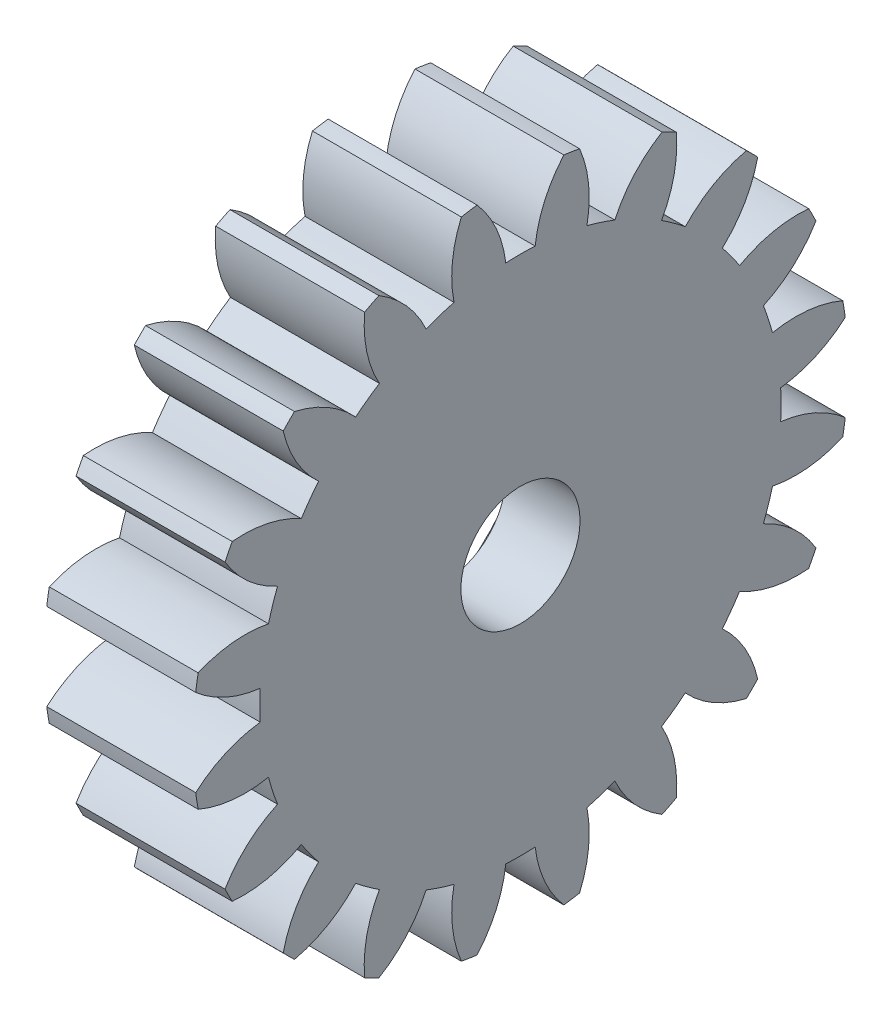
from build123d import *

# Parameters (mm, degrees)
SKETCH1_R           = 11
BOSS_EXTRUDE1_DEPTH = 10
SKETCH2_R           = 11
BOSS_EXTRUDE2_DEPTH = 5
SKETCH3_R           = 4
CUT_EXTRUDE1_DEPTH  = 5


with BuildPart() as part:
    # Sketch1 → Boss-Extrude1 (new body)
    with BuildSketch(Plane(origin=(-18.166693136, 0, 0), x_dir=(0, 0, -1), z_dir=(1, 0, 0))):
        with BuildLine():
            ThreePointArc((-32.070699567, 5.798220619), (-30.049213728, 4.506228855), (-27.735555242, 3.871695857))
            ThreePointArc((-27.735555242, 3.871695857), (-27.763365626, 2.885524266), (-27.735555242, 1.899352675))
            ThreePointArc((-27.735555242, 1.899352675), (-30.049213728, 1.264819676), (-32.070699567, -0.027172088))
            ThreePointArc((-32.070699567, -0.027172088), (-31.993509119, -0.556033965), (-31.90349429, -1.08286466))
            ThreePointArc((-31.90349429, -1.08286466), (-29.581699598, -1.686948368), (-27.185198138, -1.575465319))
            ThreePointArc((-27.185198138, -1.575465319), (-26.906903604, -2.521964119), (-26.575710576, -3.451275156))
            ThreePointArc((-26.575710576, -3.451275156), (-28.580049076, -4.76971169), (-30.103348944, -6.623142354))
            ThreePointArc((-30.103348944, -6.623142354), (-29.866509158, -7.102266728), (-29.61810033, -7.575496382))
            ThreePointArc((-29.61810033, -7.575496382), (-27.223270227, -7.432540112), (-24.978512054, -6.585953754))
            ThreePointArc((-24.978512054, -6.585953754), (-24.42135401, -7.400129864), (-23.819197819, -8.181612907))
            ThreePointArc((-23.819197819, -8.181612907), (-25.318017715, -10.054895223), (-26.194020408, -12.288338081))
            ThreePointArc((-26.194020408, -12.288338081), (-25.820714812, -12.67082492), (-25.438227972, -13.044130517))
            ThreePointArc((-25.438227972, -13.044130517), (-23.204785115, -12.168127824), (-21.331502799, -10.669307928))
            ThreePointArc((-21.331502799, -10.669307928), (-20.550019756, -11.271464119), (-19.735843645, -11.828622163))
            ThreePointArc((-19.735843645, -11.828622163), (-20.582430003, -14.073380336), (-20.725386273, -16.468210439))
            ThreePointArc((-20.725386273, -16.468210439), (-20.25215662, -16.716619266), (-19.773032246, -16.953459053))
            ThreePointArc((-19.773032246, -16.953459053), (-17.919601581, -15.430159185), (-16.601165047, -13.425820685))
            ThreePointArc((-16.601165047, -13.425820685), (-15.67185401, -13.757013713), (-14.725355211, -14.035308247))
            ThreePointArc((-14.725355211, -14.035308247), (-14.83683826, -16.431809706), (-14.232754552, -18.753604398))
            ThreePointArc((-14.232754552, -18.753604398), (-13.705923857, -18.843619227), (-13.177061979, -18.920809675))
            ThreePointArc((-13.177061979, -18.920809675), (-11.885070215, -16.899323836), (-11.250537217, -14.58566535))
            ThreePointArc((-11.250537217, -14.58566535), (-10.264365626, -14.613475734), (-9.278194034, -14.58566535))
            ThreePointArc((-9.278194034, -14.58566535), (-8.643661036, -16.899323836), (-7.351669272, -18.920809675))
            ThreePointArc((-7.351669272, -18.920809675), (-6.822807395, -18.843619227), (-6.2959767, -18.753604398))
            ThreePointArc((-6.2959767, -18.753604398), (-5.691892992, -16.431809706), (-5.803376041, -14.035308247))
            ThreePointArc((-5.803376041, -14.035308247), (-4.856877241, -13.757013713), (-3.927566204, -13.425820685))
            ThreePointArc((-3.927566204, -13.425820685), (-2.60912967, -15.430159185), (-0.755699006, -16.953459053))
            ThreePointArc((-0.755699006, -16.953459053), (-0.276574631, -16.716619266), (0.196655022, -16.468210439))
            ThreePointArc((0.196655022, -16.468210439), (0.053698752, -14.073380336), (-0.792887606, -11.828622163))
            ThreePointArc((-0.792887606, -11.828622163), (0.021288504, -11.271464119), (0.802771547, -10.669307928))
            ThreePointArc((0.802771547, -10.669307928), (2.676053863, -12.168127824), (4.909496721, -13.044130517))
            ThreePointArc((4.909496721, -13.044130517), (5.29198356, -12.67082492), (5.665289157, -12.288338081))
            ThreePointArc((5.665289157, -12.288338081), (4.789286464, -10.054895223), (3.290466568, -8.181612907))
            ThreePointArc((3.290466568, -8.181612907), (3.892622759, -7.400129864), (4.449780803, -6.585953754))
            ThreePointArc((4.449780803, -6.585953754), (6.694538976, -7.432540112), (9.089369079, -7.575496382))
            ThreePointArc((9.089369079, -7.575496382), (9.337777906, -7.102266728), (9.574617693, -6.623142354))
            ThreePointArc((9.574617693, -6.623142354), (8.051317825, -4.76971169), (6.046979325, -3.451275156))
            ThreePointArc((6.046979325, -3.451275156), (6.378172353, -2.521964119), (6.656466887, -1.575465319))
            ThreePointArc((6.656466887, -1.575465319), (9.052968347, -1.686948368), (11.374763038, -1.08286466))
            ThreePointArc((11.374763038, -1.08286466), (11.464777867, -0.556033965), (11.541968315, -0.027172088))
            ThreePointArc((11.541968315, -0.027172088), (9.520482476, 1.264819676), (7.20682399, 1.899352675))
            ThreePointArc((7.20682399, 1.899352675), (7.234634374, 2.885524266), (7.20682399, 3.871695857))
            ThreePointArc((7.20682399, 3.871695857), (9.520482476, 4.506228855), (11.541968315, 5.798220619))
            ThreePointArc((11.541968315, 5.798220619), (11.464777867, 6.327082497), (11.374763038, 6.853913192))
            ThreePointArc((11.374763038, 6.853913192), (9.052968347, 7.4579969), (6.656466887, 7.346513851))
            ThreePointArc((6.656466887, 7.346513851), (6.378172353, 8.29301265), (6.046979325, 9.222323687))
            ThreePointArc((6.046979325, 9.222323687), (8.051317825, 10.540760221), (9.574617693, 12.394190886))
            ThreePointArc((9.574617693, 12.394190886), (9.337777906, 12.87331526), (9.089369079, 13.346544914))
            ThreePointArc((9.089369079, 13.346544914), (6.694538976, 13.203588643), (4.449780803, 12.357002285))
            ThreePointArc((4.449780803, 12.357002285), (3.892622759, 13.171178396), (3.290466568, 13.952661439))
            ThreePointArc((3.290466568, 13.952661439), (4.789286464, 15.825943755), (5.665289157, 18.059386612))
            ThreePointArc((5.665289157, 18.059386612), (5.29198356, 18.441873452), (4.909496721, 18.815179048))
            ThreePointArc((4.909496721, 18.815179048), (2.676053863, 17.939176356), (0.802771547, 16.440356459))
            ThreePointArc((0.802771547, 16.440356459), (0.021288504, 17.04251265), (-0.792887606, 17.599670695))
            ThreePointArc((-0.792887606, 17.599670695), (0.053698752, 19.844428867), (0.196655022, 22.23925897))
            ThreePointArc((0.196655022, 22.23925897), (-0.276574631, 22.487667798), (-0.755699006, 22.724507584))
            ThreePointArc((-0.755699006, 22.724507584), (-2.60912967, 21.201207716), (-3.927566204, 19.196869216))
            ThreePointArc((-3.927566204, 19.196869216), (-4.856877241, 19.528062244), (-5.803376041, 19.806356778))
            ThreePointArc((-5.803376041, 19.806356778), (-5.691892992, 22.202858238), (-6.2959767, 24.52465293))
            ThreePointArc((-6.2959767, 24.52465293), (-6.822807395, 24.614667759), (-7.351669272, 24.691858207))
            ThreePointArc((-7.351669272, 24.691858207), (-8.643661036, 22.670372368), (-9.278194034, 20.356713882))
            ThreePointArc((-9.278194034, 20.356713882), (-10.264365626, 20.384524266), (-11.250537217, 20.356713882))
            ThreePointArc((-11.250537217, 20.356713882), (-11.885070215, 22.670372368), (-13.177061979, 24.691858207))
            ThreePointArc((-13.177061979, 24.691858207), (-13.705923857, 24.614667759), (-14.232754552, 24.52465293))
            ThreePointArc((-14.232754552, 24.52465293), (-14.83683826, 22.202858238), (-14.725355211, 19.806356778))
            ThreePointArc((-14.725355211, 19.806356778), (-15.67185401, 19.528062244), (-16.601165047, 19.196869216))
            ThreePointArc((-16.601165047, 19.196869216), (-17.919601581, 21.201207716), (-19.773032246, 22.724507584))
            ThreePointArc((-19.773032246, 22.724507584), (-20.25215662, 22.487667798), (-20.725386273, 22.23925897))
            ThreePointArc((-20.725386273, 22.23925897), (-20.582430003, 19.844428867), (-19.735843645, 17.599670695))
            ThreePointArc((-19.735843645, 17.599670695), (-20.550019756, 17.04251265), (-21.331502799, 16.440356459))
            ThreePointArc((-21.331502799, 16.440356459), (-23.204785115, 17.939176356), (-25.438227972, 18.815179048))
            ThreePointArc((-25.438227972, 18.815179048), (-25.820714812, 18.441873452), (-26.194020408, 18.059386612))
            ThreePointArc((-26.194020408, 18.059386612), (-25.318017715, 15.825943755), (-23.819197819, 13.952661439))
            ThreePointArc((-23.819197819, 13.952661439), (-24.42135401, 13.171178396), (-24.978512054, 12.357002285))
            ThreePointArc((-24.978512054, 12.357002285), (-27.223270227, 13.203588643), (-29.61810033, 13.346544914))
            ThreePointArc((-29.61810033, 13.346544914), (-29.866509158, 12.87331526), (-30.103348944, 12.394190886))
            ThreePointArc((-30.103348944, 12.394190886), (-28.580049076, 10.540760221), (-26.575710576, 9.222323687))
            ThreePointArc((-26.575710576, 9.222323687), (-26.906903604, 8.29301265), (-27.185198138, 7.346513851))
            ThreePointArc((-27.185198138, 7.346513851), (-29.581699598, 7.4579969), (-31.90349429, 6.853913192))
            ThreePointArc((-31.90349429, 6.853913192), (-31.993509119, 6.327082497), (-32.070699567, 5.798220619))
        make_face()
        with Locations((-10.264365626, 2.885524266)):
            Circle(SKETCH1_R, mode=Mode.SUBTRACT)
    extrude(amount=-BOSS_EXTRUDE1_DEPTH)

    # Sketch2 → Boss-Extrude2 (add)
    with BuildSketch(Plane(origin=(-18.166693136, 0, 0), x_dir=(0, 0, -1), z_dir=(1, 0, 0))):
        with Locations((-10.264365626, 2.885524266)):
            Circle(SKETCH2_R)
    extrude(amount=-BOSS_EXTRUDE2_DEPTH)

    # Sketch3 → Cut-Extrude1 (cut)
    with BuildSketch(Plane(origin=(-18.166693136, 0, 0), x_dir=(0, 0, -1), z_dir=(1, 0, 0))):
        with Locations((-10.264365626, 2.885524266)):
            Circle(SKETCH3_R)
    extrude(amount=-CUT_EXTRUDE1_DEPTH, mode=Mode.SUBTRACT)


solid = part.part
